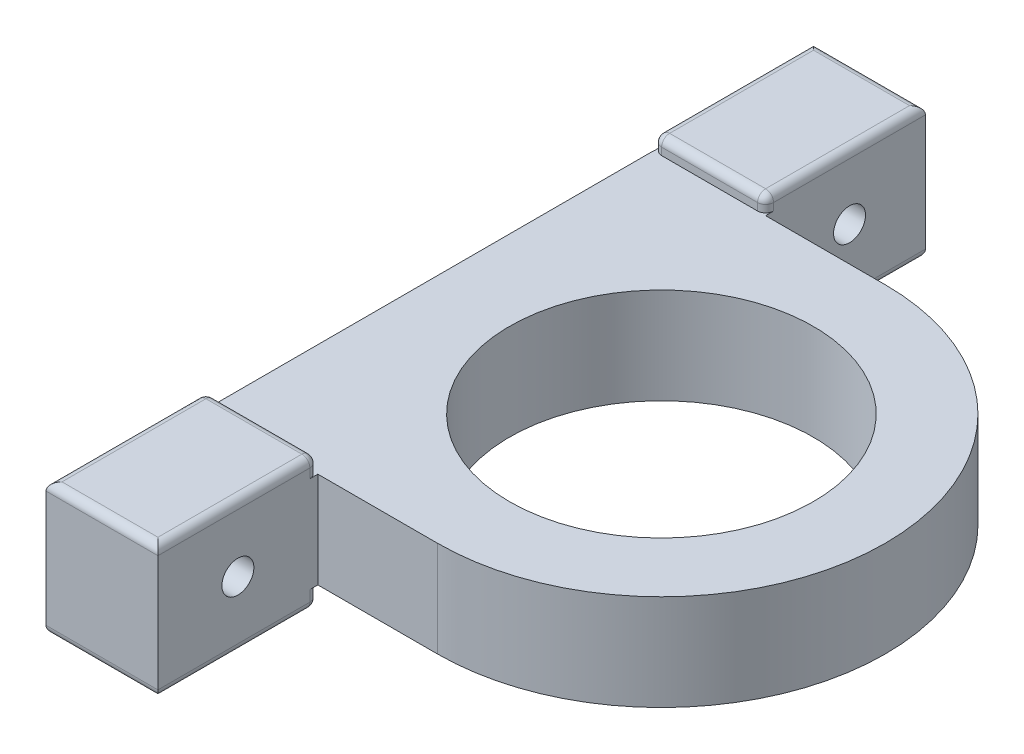
from build123d import *

# Parameters (mm, degrees)
SKETCH1_R           = 9.5
BOSS_EXTRUDE1_DEPTH = 6
SKETCH4_W           = 6.667748921
SKETCH4_H           = 8.267013878
BOSS_EXTRUDE2_DEPTH = 10
SKETCH6_W           = 10
SKETCH6_H           = 8.267013878
BOSS_EXTRUDE3_DEPTH = 7
FILLET7_R           = 0.5
FILLET9_R           = 0.5
FILLET10_R          = 0.5
FILLET12_R          = 0.5
FILLET13_R          = 0.5
SKETCH7_R           = 1
CUT_EXTRUDE1_DEPTH  = 8
SKETCH8_R           = 1
CUT_EXTRUDE2_DEPTH  = 8


with BuildPart() as part:
    # Sketch1 → Boss-Extrude1 (new body)
    with BuildSketch(Plane(origin=(0, 0, 0), x_dir=(1, 0, 0), z_dir=(0, 1, 0))):
        with BuildLine():
            Line((0, -14), (-14.5, -14))
            Line((-14.5, -14), (-14.5, 14))
            Line((-14.5, 14), (0, 14))
            ThreePointArc((0, 14), (14, 0), (0, -14))
        make_face()
        with Locations(Location((0, 0, 0), (0, 0, 270))):
            Circle(SKETCH1_R, mode=Mode.SUBTRACT)
    extrude(amount=BOSS_EXTRUDE1_DEPTH)

    # Sketch4 → Boss-Extrude2 (add)
    with BuildSketch(Plane(origin=(0, 0, -14), x_dir=(-1, 0, 0), z_dir=(0, 0, -1))):
        with Locations((11.150715383, 2.825461015)):
            Rectangle(SKETCH4_W, SKETCH4_H)
    extrude(amount=BOSS_EXTRUDE2_DEPTH)

    # Sketch6 → Boss-Extrude3 (add)
    with BuildSketch(Plane.ZY.offset(14.484589844)):
        with Locations((-19, 2.825461015)):
            Rectangle(SKETCH6_W, SKETCH6_H)
        with Locations((19, 2.950047349)):
            Rectangle(SKETCH6_W, SKETCH6_H)
    extrude(amount=-BOSS_EXTRUDE3_DEPTH)

    # Fillet7
    fillet7_edges = [part.edges().sort_by_distance(p)[0] for p in [
        (-10.984589844, -1.18345959, 14),
        (-7.484589844, -1.18345959, 19),
        (-10.984589844, -1.18345959, 24),
        (-14.484589844, -1.18345959, 19),
    ]]
    fillet(fillet7_edges, radius=FILLET7_R)

    # Fillet9
    # the kernel refuses this fillet: 0.5 mm, written as the material it takes off along each edge
    with BuildSketch(Plane(origin=(-7.984589844, -0.68345959, 14.5), x_dir=(1, 0, 0), z_dir=(0, 0, -1))) as fillet9_piece_1_section:
        Polygon((0, 0), (FILLET9_R * 1.02, 0), (FILLET9_R * 1.02, FILLET9_R * 1.02), (0, FILLET9_R * 1.02), align=None)
    fillet9_piece_1 = extrude(amount=FILLET9_R * 1.02, mode=Mode.PRIVATE)
    fillet9_piece_1 = fillet9_piece_1 - Plane(origin=(-7.984589844, -0.68345959, 14.5), x_dir=(-0.7071067811865475, 0.7071067811865475, 0), z_dir=(0, 0, -1)) * Sphere(FILLET9_R, mode=Mode.PRIVATE)
    add(fillet9_piece_1, mode=Mode.SUBTRACT)
    with BuildSketch(Plane(origin=(-7.484589844, 0, 14), x_dir=(-1, 0, 0), z_dir=(0, -1, 0))) as fillet9_piece_2:
        with BuildLine():
            CenterArc((FILLET9_R, -FILLET9_R), FILLET9_R, 90, 90)
            Line((0, -FILLET9_R), (0, 0))
            Line((0, 0), (FILLET9_R, 0))
        make_face()
    extrude(amount=0.68345959, mode=Mode.SUBTRACT)
    with BuildSketch(Plane(origin=(-15.734589844, 7.083554288, 14), x_dir=(0, -1, 0), z_dir=(1, 0, 0))) as fillet9_piece_3:
        with BuildLine():
            CenterArc((FILLET9_R, -FILLET9_R), FILLET9_R, 90, 90)
            Line((0, -FILLET9_R), (0, 0))
            Line((0, 0), (FILLET9_R, 0))
        make_face()
    extrude(amount=9.5, mode=Mode.SUBTRACT)
    with BuildSketch(Plane(origin=(-7.484589844, 8.333554288, 14), x_dir=(-1, 0, 0), z_dir=(0, -1, 0)), Plane(origin=(-14.484589844, 8.333554288, 14), x_dir=(0, 0, 1), z_dir=(0, -1, 0))) as fillet9_piece_4:
        with BuildLine():
            CenterArc((FILLET9_R, -FILLET9_R), FILLET9_R, 90, 90)
            Line((0, -FILLET9_R), (0, 0))
            Line((0, 0), (FILLET9_R, 0))
        make_face()
    extrude(amount=2.333554288, mode=Mode.SUBTRACT)

    # Fillet10
    # the kernel refuses this fillet: 0.5 mm, written as the material it takes off along each edge
    with BuildSketch(Plane(origin=(-13.984589844, 6.583554288, 14.5), x_dir=(0, 1, 0), z_dir=(-1, 0, 0))) as fillet10_piece_1_section:
        Polygon((0, 0), (FILLET10_R, 0), (FILLET10_R, FILLET10_R), (0, FILLET10_R), align=None)
    fillet10_piece_1 = extrude(amount=FILLET10_R, mode=Mode.PRIVATE)
    fillet10_piece_1 = fillet10_piece_1 - Plane(origin=(-13.984589844, 6.583554288, 14.5), x_dir=(0, -0.7071067811865475, 0.7071067811865475), z_dir=(-1, 0, 0)) * Sphere(FILLET10_R, mode=Mode.PRIVATE)
    add(fillet10_piece_1, mode=Mode.SUBTRACT)
    with BuildSketch(Plane(origin=(-7.984589844, 6.583554288, 14.5), x_dir=(1, 0, 0), z_dir=(0, 1, 0))) as fillet10_piece_2_section:
        Polygon((0, 0), (FILLET10_R, 0), (FILLET10_R, FILLET10_R), (0, FILLET10_R), align=None)
    fillet10_piece_2 = extrude(amount=FILLET10_R, mode=Mode.PRIVATE)
    fillet10_piece_2 = fillet10_piece_2 - Plane(origin=(-7.984589844, 6.583554288, 14.5), x_dir=(-0.7071067811865475, 0, 0.7071067811865475), z_dir=(0, 1, 0)) * Sphere(FILLET10_R, mode=Mode.PRIVATE)
    add(fillet10_piece_2, mode=Mode.SUBTRACT)
    with BuildSketch(Plane(origin=(-14.484589844, -1.308045924, -12.75), x_dir=(0, 1, 0), z_dir=(0, 0, -1))) as fillet10_piece_3:
        with BuildLine():
            CenterArc((FILLET10_R, FILLET10_R), FILLET10_R, 180, 90)
            Line((0, FILLET10_R), (0, 0))
            Line((0, 0), (FILLET10_R, 0))
        make_face()
    extrude(amount=12.5, mode=Mode.SUBTRACT)
    with BuildSketch(Plane(origin=(-15.734589844, -1.308045924, -14), x_dir=(0, 1, 0), z_dir=(1, 0, 0)), Plane(origin=(-15.734589844, -1.308045924, -24), x_dir=(0, 0, 1), z_dir=(1, 0, 0)), Plane(origin=(-15.734589844, 7.083554288, 24), x_dir=(0, 0, -1), z_dir=(1, 0, 0))) as fillet10_piece_4:
        with BuildLine():
            CenterArc((FILLET10_R, -FILLET10_R), FILLET10_R, 90, 90)
            Line((0, -FILLET10_R), (0, 0))
            Line((0, 0), (FILLET10_R, 0))
        make_face()
    extrude(amount=9.5, mode=Mode.SUBTRACT)
    with BuildSketch(Plane(origin=(-7.484589844, -1.308045924, -12.75), x_dir=(0, 1, 0), z_dir=(0, 0, -1))) as fillet10_piece_5:
        with BuildLine():
            CenterArc((FILLET10_R, -FILLET10_R), FILLET10_R, 90, 90)
            Line((0, -FILLET10_R), (0, 0))
            Line((0, 0), (FILLET10_R, 0))
        make_face()
    extrude(amount=12.5, mode=Mode.SUBTRACT)
    with BuildSketch(Plane(origin=(-7.484589844, 7.083554288, 25.25), x_dir=(-1, 0, 0), z_dir=(0, 0, -1)), Plane(origin=(-14.484589844, 7.083554288, 25.25), x_dir=(0, -1, 0), z_dir=(0, 0, -1))) as fillet10_piece_6:
        with BuildLine():
            CenterArc((FILLET10_R, -FILLET10_R), FILLET10_R, 90, 90)
            Line((0, -FILLET10_R), (0, 0))
            Line((0, 0), (FILLET10_R, 0))
        make_face()
    extrude(amount=10.75, mode=Mode.SUBTRACT)

    # Fillet12
    # the kernel refuses this fillet: 0.5 mm, written as the material it takes off along each edge
    with BuildSketch(Plane(origin=(-7.984589844, -0.808045924, -14.5), x_dir=(1, 0, 0), z_dir=(0, 0, 1))) as fillet12_piece_1_section:
        Polygon((0, 0), (FILLET12_R * 1.02, 0), (FILLET12_R * 1.02, -FILLET12_R * 1.02), (0, -FILLET12_R * 1.02), align=None)
    fillet12_piece_1 = extrude(amount=FILLET12_R * 1.02, mode=Mode.PRIVATE)
    fillet12_piece_1 = fillet12_piece_1 - Plane(origin=(-7.984589844, -0.808045924, -14.5), x_dir=(-0.7071067811865475, 0.7071067811865476, 0), z_dir=(0, 0, 1)) * Sphere(FILLET12_R, mode=Mode.PRIVATE)
    add(fillet12_piece_1, mode=Mode.SUBTRACT)
    with BuildSketch(Plane(origin=(-7.484589844, 0, -14), x_dir=(-1, 0, 0), z_dir=(0, -1, 0))) as fillet12_piece_2:
        with BuildLine():
            CenterArc((FILLET12_R, FILLET12_R), FILLET12_R, 180, 90)
            Line((0, FILLET12_R), (0, 0))
            Line((0, 0), (FILLET12_R, 0))
        make_face()
    extrude(amount=0.808045924, mode=Mode.SUBTRACT)
    with BuildSketch(Plane(origin=(-14.484589844, 6, -14), x_dir=(1, 0, 0), z_dir=(0, 1, 0)), Plane(origin=(-7.484589844, 8.208967954, -14), x_dir=(-1, 0, 0), z_dir=(0, -1, 0))) as fillet12_piece_3:
        with BuildLine():
            CenterArc((FILLET12_R, FILLET12_R), FILLET12_R, 180, 90)
            Line((0, FILLET12_R), (0, 0))
            Line((0, 0), (FILLET12_R, 0))
        make_face()
    extrude(amount=2.208967954, mode=Mode.SUBTRACT)
    with BuildSketch(Plane(origin=(-6.234589844, 6.958967954, -14), x_dir=(0, -1, 0), z_dir=(-1, 0, 0))) as fillet12_piece_4:
        with BuildLine():
            CenterArc((FILLET12_R, -FILLET12_R), FILLET12_R, 90, 90)
            Line((0, -FILLET12_R), (0, 0))
            Line((0, 0), (FILLET12_R, 0))
        make_face()
    extrude(amount=9.5, mode=Mode.SUBTRACT)

    # Fillet13
    # the kernel refuses this fillet: 0.5 mm, written as the material it takes off along each edge
    with BuildSketch(Plane(origin=(-13.984589844, 6.458967954, -14.5), x_dir=(0, 1, 0), z_dir=(-1, 0, 0))) as fillet13_piece_1_section:
        Polygon((0, 0), (FILLET13_R, 0), (FILLET13_R, -FILLET13_R), (0, -FILLET13_R), align=None)
    fillet13_piece_1 = extrude(amount=FILLET13_R, mode=Mode.PRIVATE)
    fillet13_piece_1 = fillet13_piece_1 - Plane(origin=(-13.984589844, 6.458967954, -14.5), x_dir=(0, -0.7071067811865475, -0.7071067811865475), z_dir=(-1, 0, 0)) * Sphere(FILLET13_R, mode=Mode.PRIVATE)
    add(fillet13_piece_1, mode=Mode.SUBTRACT)
    with BuildSketch(Plane(origin=(-7.984589844, 6.458967954, -14.5), x_dir=(0, 1, 0), z_dir=(1, 0, 0))) as fillet13_piece_2_section:
        Polygon((0, 0), (FILLET13_R, 0), (FILLET13_R, FILLET13_R), (0, FILLET13_R), align=None)
    fillet13_piece_2 = extrude(amount=FILLET13_R, mode=Mode.PRIVATE)
    fillet13_piece_2 = fillet13_piece_2 - Plane(origin=(-7.984589844, 6.458967954, -14.5), x_dir=(0, -0.7071067811865475, -0.7071067811865475), z_dir=(1, 0, 0)) * Sphere(FILLET13_R, mode=Mode.PRIVATE)
    add(fillet13_piece_2, mode=Mode.SUBTRACT)
    with BuildSketch(Plane(origin=(-7.484589844, 6.958967954, -25.25), x_dir=(0, -1, 0), z_dir=(0, 0, 1)), Plane(origin=(-14.484589844, 6.958967954, -14.5), x_dir=(0, -1, 0), z_dir=(0, 0, -1))) as fillet13_piece_3:
        with BuildLine():
            CenterArc((FILLET13_R, -FILLET13_R), FILLET13_R, 90, 90)
            Line((0, -FILLET13_R), (0, 0))
            Line((0, 0), (FILLET13_R, 0))
        make_face()
    extrude(amount=10.75, mode=Mode.SUBTRACT)
    with BuildSketch(Plane(origin=(-6.234589844, 6.958967954, -24), x_dir=(0, 0, 1), z_dir=(-1, 0, 0))) as fillet13_piece_4:
        with BuildLine():
            CenterArc((FILLET13_R, -FILLET13_R), FILLET13_R, 90, 90)
            Line((0, -FILLET13_R), (0, 0))
            Line((0, 0), (FILLET13_R, 0))
        make_face()
    extrude(amount=9.5, mode=Mode.SUBTRACT)

    # Sketch7 → Cut-Extrude1 (cut)
    with BuildSketch(Plane.ZY.offset(14.484589844)):
        with Locations((-19.25, 2.908270205)):
            Circle(SKETCH7_R)
    extrude(amount=-CUT_EXTRUDE1_DEPTH, mode=Mode.SUBTRACT)

    # Sketch8 → Cut-Extrude2 (cut)
    with BuildSketch(Plane.ZY.offset(14.484589844)):
        with Locations((19, 2.950047349)):
            Circle(SKETCH8_R)
    extrude(amount=-CUT_EXTRUDE2_DEPTH, mode=Mode.SUBTRACT)


solid = part.part
